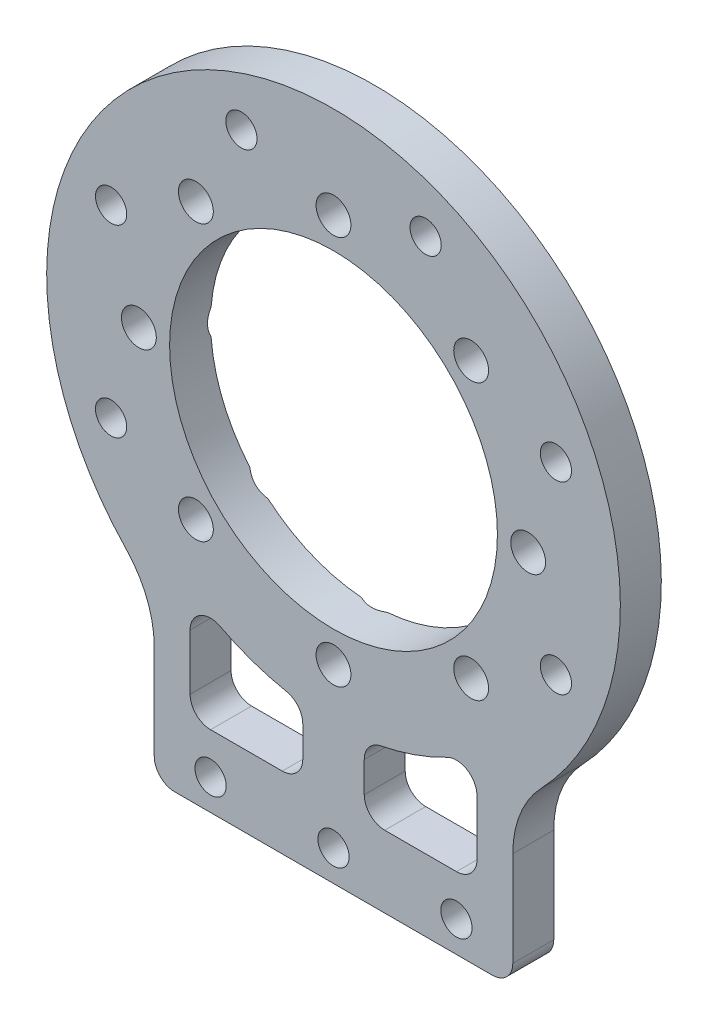
from build123d import *

# Parameters (mm, degrees)
SKETCH_2_R                   = 28
SKETCH_2_R_2                 = 1.525
SKETCH_2_W                   = 35
SKETCH_2_H                   = 15.642507006
EXTRUDE_1_DEPTH              = 4
SKETCH_3_R                   = 16
CUT_EXTRUDE_1_DEPTH          = 47.97073557
SKETCH_4_R                   = 1.525
CUT_EXTRUDE_2_DEPTH          = 47.97073557
FILLET_1_R                   = 2
FILLET_2_R                   = 10
CUT_EXTRUDE_START            = -4
CUT_EXTRUDE_3_DEPTH          = 4
FILLET_3_R                   = 2
SKETCH_7_R                   = 1.525
CUT_EXTRUDE_4_DEPTH          = 47.97073557
HOLE_WIZARD_M3_1_D           = 3.4
HOLE_WIZARD_M3_1_CSINK_D     = 6.6
HOLE_WIZARD_M3_1_CSINK_ANGLE = 90


# Read off the part's stored shape, not the designer's step: 切除-拉伸3
with BuildPart() as part:
    # 草图2 → 凸台-拉伸1 (new body)
    # profile 1 of 2: a face of its own
    with BuildSketch(Plane.XY):
        Circle(SKETCH_2_R)
        with Locations((19, 0)):
            Circle(SKETCH_2_R_2, mode=Mode.SUBTRACT)
        with Locations((13.435028843, -13.435028843)):
            Circle(SKETCH_2_R_2, mode=Mode.SUBTRACT)
        with Locations((0, -19)):
            Circle(SKETCH_2_R_2, mode=Mode.SUBTRACT)
        with Locations((-13.435028843, -13.435028843)):
            Circle(SKETCH_2_R_2, mode=Mode.SUBTRACT)
        with Locations((-19, 0)):
            Circle(SKETCH_2_R_2, mode=Mode.SUBTRACT)
        with Locations((-13.435028843, 13.435028843)):
            Circle(SKETCH_2_R_2, mode=Mode.SUBTRACT)
        with Locations((0, 19)):
            Circle(SKETCH_2_R_2, mode=Mode.SUBTRACT)
        with Locations((13.435028843, 13.435028843)):
            Circle(SKETCH_2_R_2, mode=Mode.SUBTRACT)
    # profile 2 of 2: a face of its own
    with BuildSketch(Plane.XY):
        with Locations((0, -29.678746497)):
            Rectangle(SKETCH_2_W, SKETCH_2_H)
    extrude(amount=EXTRUDE_1_DEPTH)

    # 草图3 → 切除-拉伸1 (cut, through all)
    with BuildSketch(Plane.XY.offset(4)):
        Circle(SKETCH_3_R)
    extrude(amount=-CUT_EXTRUDE_1_DEPTH, mode=Mode.SUBTRACT)

    # 草图4 → 切除-拉伸2 (cut, through all)
    with BuildSketch(Plane.XY.offset(4)):
        with Locations((0, -34.5)):
            Circle(SKETCH_4_R)
        with Locations((-12, -34.5)):
            Circle(SKETCH_4_R)
        with Locations(Location((12, -34.5, 0), (0, 0, 180))):
            Circle(SKETCH_4_R)
    extrude(amount=-CUT_EXTRUDE_2_DEPTH, mode=Mode.SUBTRACT)

    # 圆角1
    fillet_1_edges = [part.edges().sort_by_distance(p)[0] for p in [
        (17.5, -37.5, 2),
        (-17.5, -37.5, 2),
    ]]
    fillet(fillet_1_edges, radius=FILLET_1_R)

    # 圆角2
    fillet_2_edges = [part.edges().sort_by_distance(p)[0] for p in [
        (17.5, -21.857492994, 2),
        (-17.5, -21.857492994, 2),
    ]]
    fillet(fillet_2_edges, radius=FILLET_2_R)

    # 切除-拉伸3 outline → 切除-拉伸3 (cut)
    with BuildSketch(Plane.XY.offset(4).offset(CUT_EXTRUDE_START)):
        with BuildLine():
            ThreePointArc((14, -19.49358869), (8.769929005, -22.340285254), (3, -23.8117618))
            Line((3, -23.8117618), (3, -30.49358869))
            Line((3, -30.49358869), (14, -30.49358869))
            Line((14, -30.49358869), (14, -19.49358869))
        make_face()
        with BuildLine():
            ThreePointArc((-3, -23.8117618), (-8.769929005, -22.340285254), (-14, -19.49358869))
            Line((-14, -19.49358869), (-14, -30.49358869))
            Line((-14, -30.49358869), (-3, -30.49358869))
            Line((-3, -30.49358869), (-3, -23.8117618))
        make_face()
    extrude(amount=CUT_EXTRUDE_3_DEPTH, mode=Mode.SUBTRACT)

    # 圆角3
    fillet_3_edges = [part.edges().sort_by_distance(p)[0] for p in [
        (-14, -19.49358869, 2),
        (-3, -23.8117618, 2),
        (-3, -30.49358869, 2),
        (-14, -30.49358869, 2),
        (3, -23.8117618, 2),
        (14, -19.49358869, 2),
        (14, -30.49358869, 2),
        (3, -30.49358869, 2),
    ]]
    fillet(fillet_3_edges, radius=FILLET_3_R)

    # 草图7 → 切除-拉伸4 (cut, through all)
    with BuildSketch(Plane.XY.offset(4)):
        with Locations((21.711169014, 8.993060661)):
            Circle(SKETCH_7_R)
        with Locations((21.711169014, -8.993060661)):
            Circle(SKETCH_7_R)
        with Locations((-21.711169014, -8.993060661)):
            Circle(SKETCH_7_R)
        with Locations((-21.711169014, 8.993060661)):
            Circle(SKETCH_7_R)
        with Locations((-8.993060661, 21.711169014)):
            Circle(SKETCH_7_R)
        with Locations((8.993060661, 21.711169014)):
            Circle(SKETCH_7_R)
    extrude(amount=-CUT_EXTRUDE_4_DEPTH, mode=Mode.SUBTRACT)

    # M3 开槽沉头木螺钉的锥形沉头孔1 (through all)
    with Locations(Plane(origin=(0, 0, 0), x_dir=(-1, 0, 0), z_dir=(0, 0, -1))):
        with Locations((-19, 0), (-13.435028842, 13.435028843), (0, 19), (13.435028843, 13.435028843), (19, 0), (13.435028843, -13.435028843), (0, -19), (-13.435028843, -13.435028843)):
            CounterSinkHole(HOLE_WIZARD_M3_1_D / 2, HOLE_WIZARD_M3_1_CSINK_D / 2, counter_sink_angle=HOLE_WIZARD_M3_1_CSINK_ANGLE)


solid = part.part
